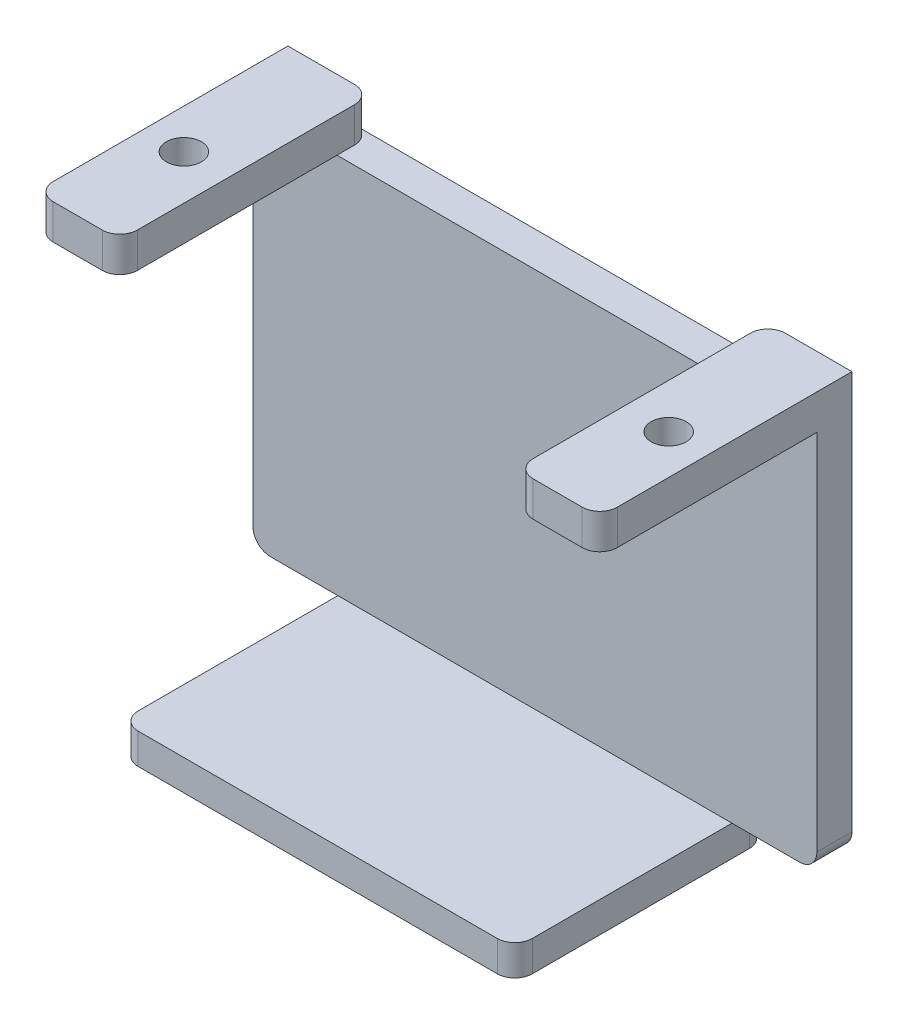
from build123d import *

# Parameters (mm, degrees)
SKETCH1_W           = 32.2
SKETCH1_H           = 25.5
BOSS_EXTRUDE1_DEPTH = 14.4
SKETCH3_W           = 32.2
SKETCH3_H           = 21.75
CUT_EXTRUDE1_DEPTH  = 12.4
SKETCH5_W           = 22.6
SKETCH5_H           = 2
CUT_EXTRUDE2_DEPTH  = 14.4
FILLET1_R           = 1
FILLET2_R           = 1
FILLET3_R           = 1
FILLET4_R           = 1
SKETCH10_R          = 1
CUT_EXTRUDE3_DEPTH  = 10
SKETCH11_W          = 4.85
SKETCH11_H          = 1.75
CUT_EXTRUDE4_DEPTH  = 20
FILLET5_R           = 1
FILLET6_R           = 1


with BuildPart() as part:
    # Sketch1 → Boss-Extrude1 (new body)
    with BuildSketch(Plane.XY):
        Rectangle(SKETCH1_W, SKETCH1_H)
    extrude(amount=BOSS_EXTRUDE1_DEPTH)

    # Sketch3 → Cut-Extrude1 (cut)
    with BuildSketch(Plane.XY.offset(14.4)):
        with Locations((0, -0.125)):
            Rectangle(SKETCH3_W, SKETCH3_H)
    extrude(amount=-CUT_EXTRUDE1_DEPTH, mode=Mode.SUBTRACT)

    # Sketch5 → Cut-Extrude2 (cut)
    with BuildSketch(Plane.XY.offset(14.4)):
        with Locations((0, 11.75)):
            Rectangle(SKETCH5_W, SKETCH5_H)
    extrude(amount=-CUT_EXTRUDE2_DEPTH, mode=Mode.SUBTRACT)

    # Fillet1
    fillet1_edges = [part.edges().sort_by_distance(p)[0] for p in [
        (-11.3, 11.75, 14.4),
    ]]
    fillet(fillet1_edges, radius=FILLET1_R)

    # Fillet2
    fillet2_edges = [part.edges().sort_by_distance(p)[0] for p in [
        (-16.1, 11.75, 14.4),
    ]]
    fillet(fillet2_edges, radius=FILLET2_R)

    # Fillet3
    fillet3_edges = [part.edges().sort_by_distance(p)[0] for p in [
        (11.3, 11.75, 14.4),
    ]]
    fillet(fillet3_edges, radius=FILLET3_R)

    # Fillet4
    fillet4_edges = [part.edges().sort_by_distance(p)[0] for p in [
        (16.1, 11.75, 14.4),
    ]]
    fillet(fillet4_edges, radius=FILLET4_R)

    # Sketch10 → Cut-Extrude3 (cut)
    with BuildSketch(Plane(origin=(0, 12.75, 0), x_dir=(1, 0, 0), z_dir=(0, 1, 0))):
        with Locations((-13.84, -8.203047487)):
            Circle(SKETCH10_R)
    cut_extrude3 = extrude(amount=-CUT_EXTRUDE3_DEPTH, mode=Mode.SUBTRACT)

    # Mirror1: Cut-Extrude3 across plane
    add(cut_extrude3.mirror(Plane(origin=(0, 0, 0), x_dir=(0, 0, 1), z_dir=(1, 0, 0))), mode=Mode.SUBTRACT)

    # Sketch11 → Cut-Extrude4 (cut)
    with BuildSketch(Plane.XY.offset(14.4)):
        with Locations((-13.675, -11.875)):
            Rectangle(SKETCH11_W, SKETCH11_H)
    cut_extrude4 = extrude(amount=-CUT_EXTRUDE4_DEPTH, mode=Mode.SUBTRACT)

    # Mirror2: Cut-Extrude4 across plane
    add(cut_extrude4.mirror(Plane(origin=(0, 0, 0), x_dir=(0, 0, 1), z_dir=(1, 0, 0))), mode=Mode.SUBTRACT)

    # Fillet5
    fillet5_edges = [part.edges().sort_by_distance(p)[0] for p in [
        (-11.25, -11.875, 0),
        (-16.1, -11, 1),
        (16.1, -11, 1),
        (11.25, -11.875, 0),
        (11.25, -11.875, 14.4),
        (-11.25, -11.875, 14.4),
    ]]
    fillet(fillet5_edges, radius=FILLET5_R)

    # Fillet6
    fillet6_edges = [part.edges().sort_by_distance(p)[0] for p in [
        (-11.3, 11.75, 0),
        (11.3, 11.75, 0),
    ]]
    fillet(fillet6_edges, radius=FILLET6_R)


solid = part.part
